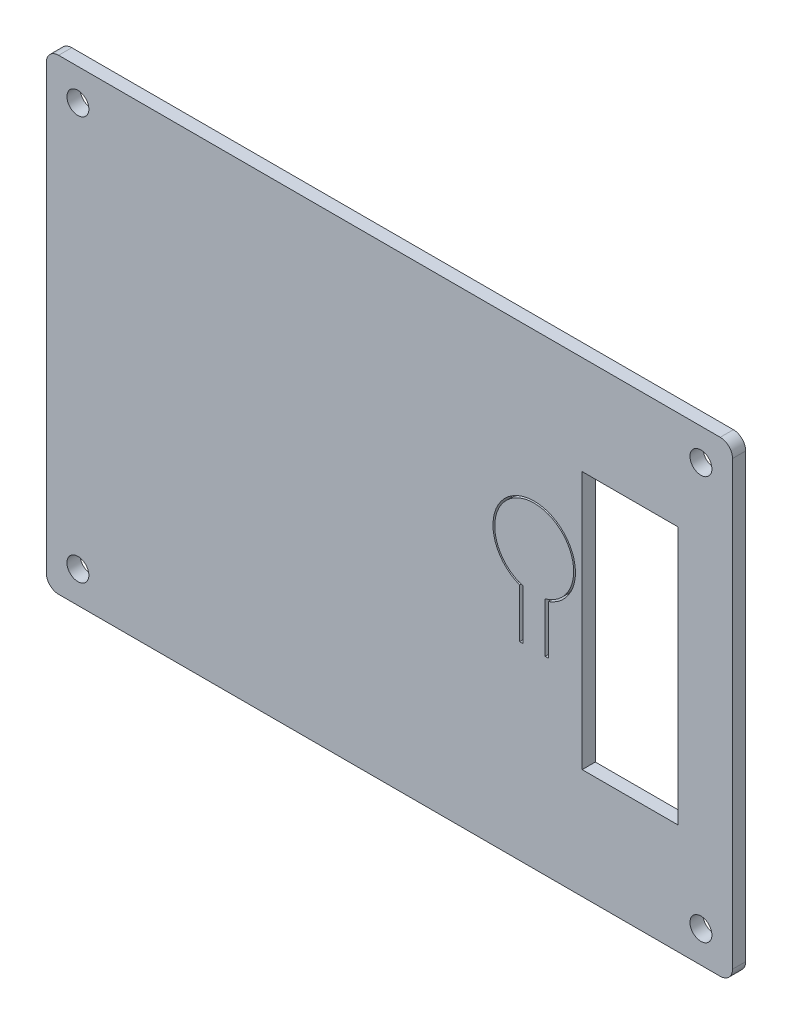
from build123d import *

# Parameters (mm, degrees)
SKETCH1_R           = 1.25
SKETCH1_W           = 10.925559674
SKETCH1_H           = 29.413801758
BOSS_EXTRUDE1_DEPTH = 1.5
CUT_EXTRUDE1_DEPTH  = 2.5
CUT_EXTRUDE6_START  = -1.5
CUT_EXTRUDE6_DEPTH  = 1
FILLET1_R           = 1


# Read off the part's stored shape, not the designer's step: Cut-Extrude6
with BuildPart() as part:
    # Sketch1 → Boss-Extrude1 (new body)
    with BuildSketch(Plane.XY.offset(12.743078908)):
        with BuildLine():
            Line((29.564858702, -24.475637141), (29.564858702, 25.924362859))
            ThreePointArc((29.564858702, 25.924362859), (29.154808195, 26.914312353), (28.164858702, 27.324362859))
            Line((28.164858702, 27.324362859), (-47.235141298, 27.324362859))
            ThreePointArc((-47.235141298, 27.324362859), (-48.225090792, 26.914312353), (-48.635141298, 25.924362859))
            Line((-48.635141298, 25.924362859), (-48.635141298, -24.475637141))
            ThreePointArc((-48.635141298, -24.475637141), (-48.225090792, -25.465586635), (-47.235141298, -25.875637141))
            Line((-47.235141298, -25.875637141), (28.164858702, -25.875637141))
            ThreePointArc((28.164858702, -25.875637141), (29.154808195, -25.465586635), (29.564858702, -24.475637141))
        make_face()
        with Locations((-45.035141298, -22.275637141)):
            Circle(SKETCH1_R, mode=Mode.SUBTRACT)
        with Locations((-45.035141298, 23.724362859)):
            Circle(SKETCH1_R, mode=Mode.SUBTRACT)
        with Locations((25.964858702, -22.275637141)):
            Circle(SKETCH1_R, mode=Mode.SUBTRACT)
        with Locations((25.964858702, 23.724362859)):
            Circle(SKETCH1_R, mode=Mode.SUBTRACT)
        with Locations((17.892390482, 1.364242189)):
            Rectangle(SKETCH1_W, SKETCH1_H, mode=Mode.SUBTRACT)
    extrude(amount=BOSS_EXTRUDE1_DEPTH)

    # Sketch2 → Cut-Extrude1 (cut)
    with BuildSketch(Plane.XY.offset(14.243078908)):
        with BuildLine():
            ThreePointArc((8.614677666, 1.323444705), (8.416130841, 1.254039367), (8.214677666, 1.193586405))
            Line((8.214677666, 1.193586405), (8.214677666, -4.275635234))
            Line((8.214677666, -4.275635234), (8.614677666, -4.275635234))
            Line((8.614677666, -4.275635234), (8.614677666, 1.323444705))
        make_face()
        with BuildLine():
            ThreePointArc((11.464858702, 5.724364766), (10.684682981, 3.191992888), (8.614677666, 1.537707701))
            Line((8.614677666, 1.537707701), (8.614677666, 1.323444705))
            ThreePointArc((8.614677666, 1.323444705), (10.827768818, 3.047066607), (11.664858702, 5.724364766))
            ThreePointArc((11.664858702, 5.724364766), (4.287560542, 9.587274882), (5.315039737, 1.323444705))
            Line((5.315039737, 1.323444705), (5.315039737, 1.537707701))
            ThreePointArc((5.315039737, 1.537707701), (4.432486823, 9.444189046), (11.464858702, 5.724364766))
        make_face()
        with BuildLine():
            ThreePointArc((8.614677666, 1.537707701), (8.416278493, 1.464860031), (8.214677666, 1.401408306))
            Line((8.214677666, 1.401408306), (8.214677666, 1.193586405))
            ThreePointArc((8.214677666, 1.193586405), (8.416130841, 1.254039367), (8.614677666, 1.323444705))
            Line((8.614677666, 1.323444705), (8.614677666, 1.537707701))
        make_face()
        with BuildLine():
            Line((5.715039737, -4.275635234), (5.715039737, 1.193586405))
            ThreePointArc((5.715039737, 1.193586405), (5.513586562, 1.254039367), (5.315039737, 1.323444705))
            Line((5.315039737, 1.323444705), (5.315039737, -4.275635234))
            Line((5.315039737, -4.275635234), (5.715039737, -4.275635234))
        make_face()
        with BuildLine():
            Line((5.715039737, 1.193586405), (5.715039737, 1.401408306))
            ThreePointArc((5.715039737, 1.401408306), (5.51343891, 1.464860031), (5.315039737, 1.537707701))
            Line((5.315039737, 1.537707701), (5.315039737, 1.323444705))
            ThreePointArc((5.315039737, 1.323444705), (5.513586562, 1.254039367), (5.715039737, 1.193586405))
        make_face()
    extrude(amount=-CUT_EXTRUDE1_DEPTH, mode=Mode.SUBTRACT)

    # Cut-Extrude6 outline → Cut-Extrude6 (cut)
    with BuildSketch(Plane.XY.offset(14.243078908).offset(CUT_EXTRUDE6_START)):
        with BuildLine():
            Line((5.715039737, 1.401408306), (5.715039737, -4.275635234))
            Line((5.715039737, -4.275635234), (8.214677666, -4.275635234))
            Line((8.214677666, -4.275635234), (8.214677666, 1.401408306))
            ThreePointArc((8.214677666, 1.401408306), (6.964858701, 10.224364766), (5.715039737, 1.401408306))
        make_face()
    extrude(amount=CUT_EXTRUDE6_DEPTH, mode=Mode.SUBTRACT)

    # Fillet1
    fillet1_edges = [part.edges().sort_by_distance(p)[0] for p in [
        (6.964858701, -4.275635234, 13.743078908),
    ]]
    fillet(fillet1_edges, radius=FILLET1_R - 0.0001)  # a hair under: the kernel refuses the full size


solid = part.part
